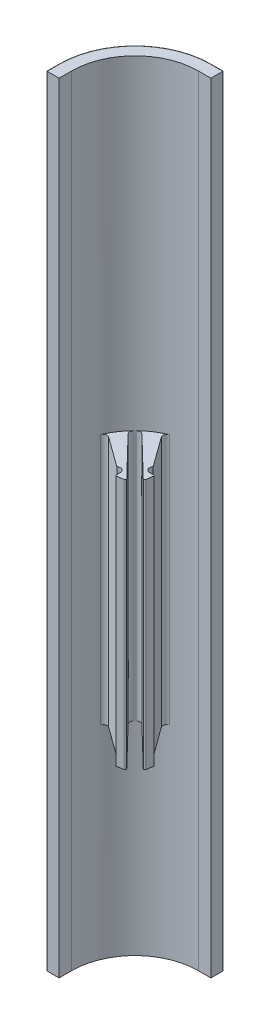
from build123d import *

# Parameters (mm, degrees)
STOCK_OUTTER_CASE_1_START = -4
STOCK_OUTTER_CASE_1_DEPTH = 184.8
FILLET1_R                 = 0.2
BOSS_EXTRUDE4_DEPTH       = 29.8
FILLET3_R                 = 0.3
FILLET4_R                 = 1


# Read off the part's stored shape, not the designer's step: Stock-outter_case-1
with BuildPart() as part:
    # Stock-outter_case-1 outline → Stock-outter_case-1 (new body)
    with BuildSketch(Plane(origin=(0, 0, 0), x_dir=(1, 0, 0), z_dir=(0, 1, 0)).offset(STOCK_OUTTER_CASE_1_START)):
        with BuildLine():
            Line((-138, 93), (-135, 93))
            Line((-135, 93), (-135, 96))
            Line((-135, 96), (-138, 96))
            ThreePointArc((-138, 96), (-150.727922061, 90.727922061), (-156, 78))
            Line((-156, 78), (-156, 75))
            Line((-156, 75), (-153, 75))
            Line((-153, 75), (-153, 78))
            ThreePointArc((-153, 78), (-148.606601718, 88.606601718), (-138, 93))
        make_face()
    extrude(amount=STOCK_OUTTER_CASE_1_DEPTH)

    # Fillet1
    fillet1_edges = [part.edges().sort_by_distance(p)[0] for p in [
        (-150.727922061, 180.8, -90.727922061),
        (-156, 180.8, -76.5),
        (-136.5, 180.8, -96),
        (-150.727922061, -4, -90.727922061),
        (-156, -4, -76.5),
        (-136.5, -4, -96),
        (-156, 88.4, -75),
        (-135, 88.4, -96),
    ]]
    fillet(fillet1_edges, radius=FILLET1_R)

    # Sketch5 → Boss-Extrude4 (add, symmetric)
    with BuildSketch(Plane(origin=(0, 74, 0), x_dir=(1, 0, 0), z_dir=(0, 1, 0))):
        with BuildLine():
            Line((-137.385981926, 79.358072098), (-137.056795696, 81.56280876))
            ThreePointArc((-137.056795696, 81.56280876), (-137.228508787, 81.694568849), (-137.439817918, 81.741414955))
            Line((-137.439817918, 81.741414955), (-138.298334245, 81.741414955))
            ThreePointArc((-138.298334245, 81.741414955), (-139.204642032, 82.318796694), (-139.064378688, 83.384202565))
            Line((-139.064378688, 83.384202565), (-144.848487028, 91.34534471))
            ThreePointArc((-144.848487028, 91.34534471), (-146.365861195, 90.450396237), (-147.767847562, 89.383723205))
            Line((-147.767847562, 89.383723205), (-137.385981926, 79.358072098))
        make_face()
    boss_extrude4 = extrude(amount=BOSS_EXTRUDE4_DEPTH, both=True)

    # Mirror2: Boss-Extrude4 across plane
    add(boss_extrude4.mirror(Plane(origin=(-30, 0, 30), x_dir=(0.7071067811865478, 0, 0.7071067811865472), z_dir=(0.7071067811865475, 0, -0.7071067811865477))))

    # Fillet3
    fillet3_edges = [part.edges().sort_by_distance(p)[0] for p in [
        (-137.385981926, 74, -79.358072098),
        (-139.358072098, 74, -77.385981926),
    ]]
    fillet(fillet3_edges, radius=FILLET3_R)

    # Fillet4
    fillet4_edges = [part.edges().sort_by_distance(p)[0] for p in [
        (-147.767847562, 74, -89.383723205),
        (-144.848487028, 74, -91.34534471),
        (-151.34534471, 74, -84.848487028),
        (-149.383723205, 74, -87.767847562),
    ]]
    fillet(fillet4_edges, radius=FILLET4_R)


solid = part.part
